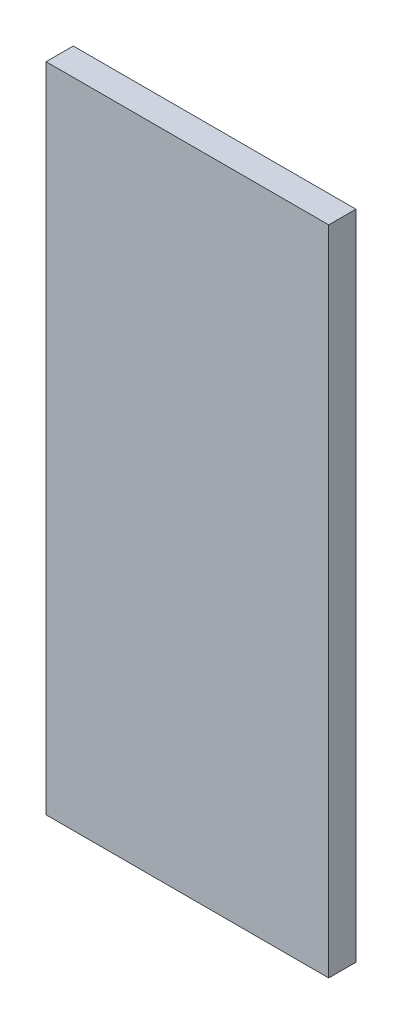
from build123d import *

# Parameters (mm, degrees)
SKETCH1_W           = 66.04
SKETCH1_H           = 152.4
BOSS_EXTRUDE1_DEPTH = 6.35


with BuildPart() as part:
    # Sketch1 → Boss-Extrude1 (new body)
    with BuildSketch(Plane.XY):
        with Locations((-1.883639144, 35.459021407)):
            Rectangle(SKETCH1_W, SKETCH1_H)
    extrude(amount=BOSS_EXTRUDE1_DEPTH)


solid = part.part
